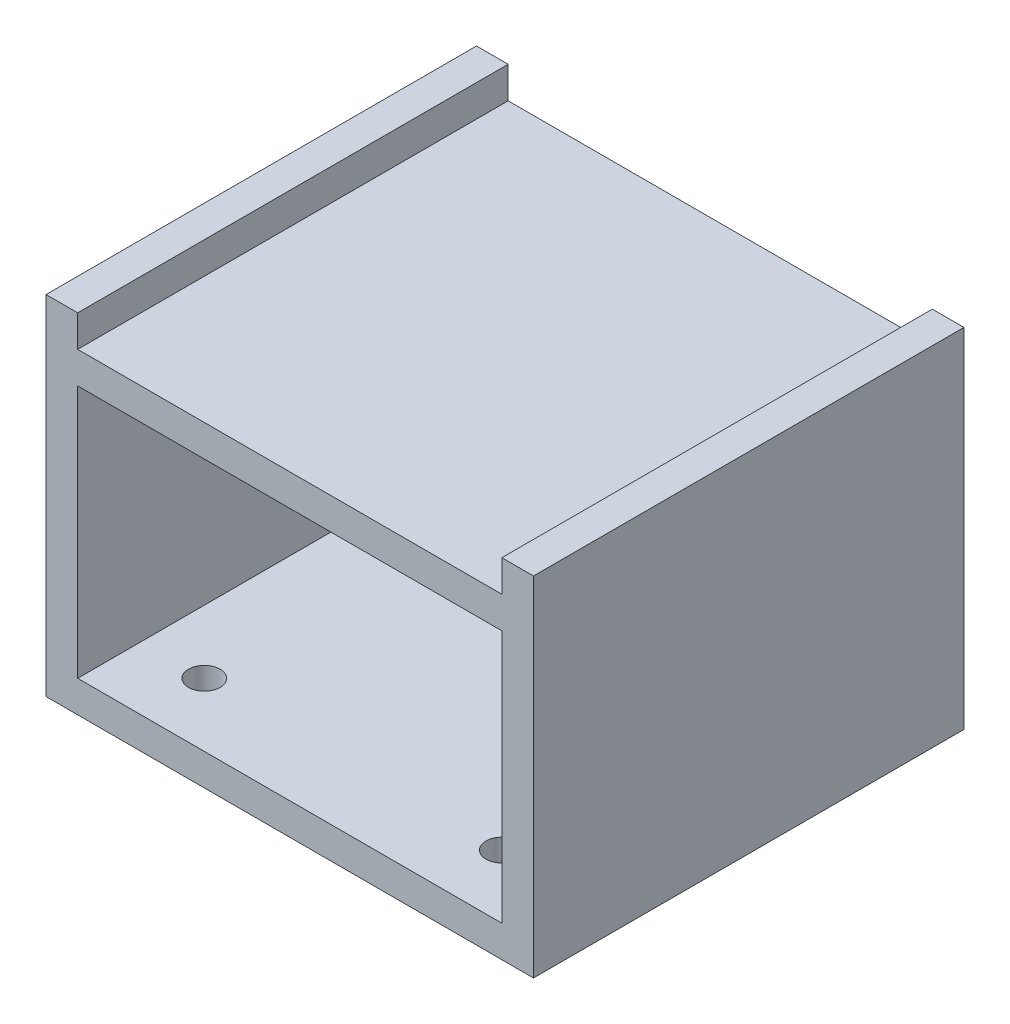
from build123d import *

# Parameters (mm, degrees)
SKETCH1_W               = 86.36
SKETCH1_H               = 63.5
BOSS_EXTRUDE1_DEPTH     = 97.79
SKETCH2_W               = 6.35
SKETCH2_H               = 86.36
BOSS_EXTRUDE2_DEPTH     = 6.35
CUT_EXTRUDE2_DEPTH      = 114.485710554
CUT_EXTRUDE2_DEPTH_BACK = 114.485710554
SKETCH4_W               = 85.09
SKETCH4_H               = 50.8
SKETCH5_R               = 3.175
CUT_EXTRUDE3_DEPTH      = 125.336826805


with BuildPart() as part:
    # Sketch1 → Boss-Extrude1 (new body)
    with BuildSketch(Plane(origin=(0, 0, 0), x_dir=(0, 0, -1), z_dir=(1, 0, 0))):
        Rectangle(SKETCH1_W, SKETCH1_H)
    extrude(amount=BOSS_EXTRUDE1_DEPTH)

    # Sketch2 → Boss-Extrude2 (add)
    with BuildSketch(Plane(origin=(0, 31.75, 0), x_dir=(1, 0, 0), z_dir=(0, 1, 0))):
        with Locations((94.615, 0)):
            Rectangle(SKETCH2_W, SKETCH2_H)
        with Locations((3.175, 0)):
            Rectangle(SKETCH2_W, SKETCH2_H)
    extrude(amount=BOSS_EXTRUDE2_DEPTH)

    # Sketch4 → Cut-Extrude2 (cut, two sides: drawn at the far end of the back side and taken through both)
    with BuildSketch(Plane.XY.offset(-CUT_EXTRUDE2_DEPTH_BACK)):
        with Locations((48.895, 0)):
            Rectangle(SKETCH4_W, SKETCH4_H)
    extrude(amount=CUT_EXTRUDE2_DEPTH + CUT_EXTRUDE2_DEPTH_BACK, mode=Mode.SUBTRACT)

    # Sketch5 → Cut-Extrude3 (cut, through all)
    with BuildSketch(Plane(origin=(0, -25.4, 0), x_dir=(1, 0, 0), z_dir=(0, 1, 0))):
        with Locations((19.05, 30.48)):
            Circle(SKETCH5_R)
        with Locations((78.74, 30.48)):
            Circle(SKETCH5_R)
        with Locations((78.74, -30.48)):
            Circle(SKETCH5_R)
        with Locations((19.05, -30.48)):
            Circle(SKETCH5_R)
    extrude(amount=-CUT_EXTRUDE3_DEPTH, mode=Mode.SUBTRACT)


solid = part.part
